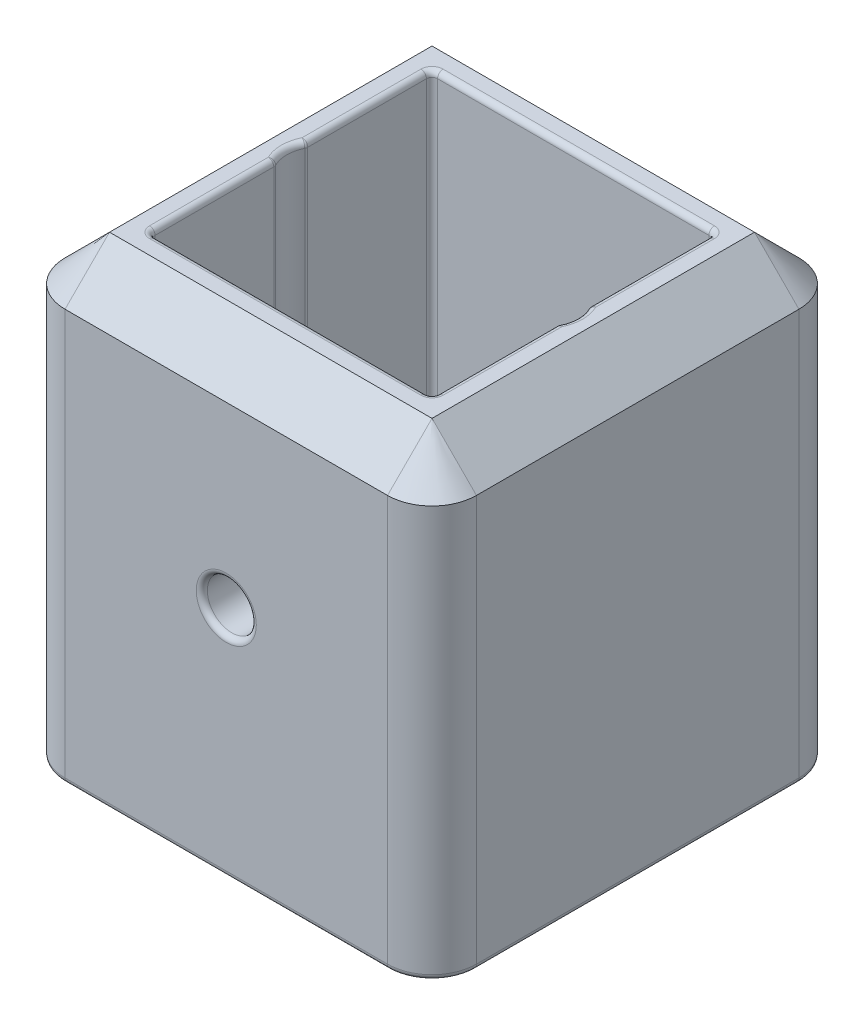
from build123d import *

# Parameters (mm, degrees)
SKIZZE1_W                        = 37
SKIZZE1_H                        = 37
SKIZZE1_R                        = 1.7
AUFSATZ_LINEAR_AUSTRAGEN1_DEPTH  = 6
SKIZZE2_W                        = 37
SKIZZE2_H                        = 37
AUFSATZ_LINEAR_AUSTRAGEN2_DEPTH  = 35
VERRUNDUNG1_R                    = 4
VERRUNDUNG4_R                    = 0.5
VERRUNDUNG5_R                    = 0.5
FASE1_SIZE                       = 4
F_4_4_4_4_DURCHMESSER_BOHRUNG1_D = 4.4
VERRUNDUNG6_R                    = 0.5
SKIZZE5_R                        = 5.5
SCHNITT_LINEAR_AUSTRAGEN1_DEPTH  = 2


with BuildPart() as part:
    # Skizze1 → Aufsatz-Linear austragen1 (new body)
    with BuildSketch(Plane(origin=(0, 0, 0), x_dir=(1, 0, 0), z_dir=(0, 1, 0))):
        Rectangle(SKIZZE1_W, SKIZZE1_H)
        with Locations(Location((10.25, 0, 0), (0, 0, 270))):
            Circle(SKIZZE1_R, mode=Mode.SUBTRACT)
        with Locations(Location((5.125, -8.876760389, 0), (0, 0, 270))):
            Circle(SKIZZE1_R, mode=Mode.SUBTRACT)
        with Locations(Location((-5.125, -8.876760389, 0), (0, 0, 270))):
            Circle(SKIZZE1_R, mode=Mode.SUBTRACT)
        with Locations(Location((-10.25, 0, 0), (0, 0, 270))):
            Circle(SKIZZE1_R, mode=Mode.SUBTRACT)
        with Locations(Location((-5.125, 8.876760389, 0), (0, 0, 270))):
            Circle(SKIZZE1_R, mode=Mode.SUBTRACT)
        with Locations(Location((5.125, 8.876760389, 0), (0, 0, 270))):
            Circle(SKIZZE1_R, mode=Mode.SUBTRACT)
    extrude(amount=-AUFSATZ_LINEAR_AUSTRAGEN1_DEPTH)

    # Skizze2 → Aufsatz-Linear austragen2 (add)
    with BuildSketch(Plane(origin=(0, 0, 0), x_dir=(1, 0, 0), z_dir=(0, 1, 0))):
        Rectangle(SKIZZE2_W, SKIZZE2_H)
        with BuildLine():
            Line((12.7, 12.7), (7.592597401, 12.7))
            Line((7.592597401, 12.7), (-2.657402599, 12.7))
            Line((-2.657402599, 12.7), (-12.7, 12.7))
            Line((-12.7, 12.7), (-12.7, 3.905508149))
            Line((-12.7, 3.905508149), (-12.7, 1.406236111))
            ThreePointArc((-12.7, 1.406236111), (-13.05, 0), (-12.7, -1.406236111))
            Line((-12.7, -1.406236111), (-12.7, -12.7))
            Line((-12.7, -12.7), (-7.592597401, -12.7))
            Line((-7.592597401, -12.7), (12.7, -12.7))
            Line((12.7, -12.7), (12.7, -3.905508149))
            Line((12.7, -3.905508149), (12.7, -1.406236111))
            ThreePointArc((12.7, -1.406236111), (13.05, 0), (12.7, 1.406236111))
            Line((12.7, 1.406236111), (12.7, 12.7))
        make_face(mode=Mode.SUBTRACT)
    extrude(amount=AUFSATZ_LINEAR_AUSTRAGEN2_DEPTH)

    # Verrundung1
    verrundung1_edges = [part.edges().sort_by_distance(p)[0] for p in [
        (-18.5, 14.5, -18.5),
        (18.5, 14.5, -18.5),
        (18.5, 14.5, 18.5),
        (-18.5, 14.5, 18.5),
    ]]
    fillet(verrundung1_edges, radius=VERRUNDUNG1_R)

    # Verrundung4
    verrundung4_edges = [part.edges().sort_by_distance(p)[0] for p in [
        (-10.25, -6, -1.7),
        (-10.25, 0, -1.7),
        (-5.125, -6, -10.576760389),
        (-5.125, 0, -10.576760389),
        (5.125, -6, -10.576760389),
        (5.125, 0, -10.576760389),
        (10.25, -6, -1.7),
        (10.25, 0, -1.7),
        (-5.125, -6, 7.176760389),
        (-5.125, 0, 7.176760389),
        (5.125, -6, 7.176760389),
        (5.125, 0, 7.176760389),
        (-18.5, -6, 0),
        (0, -6, 18.5),
        (0, -6, -18.5),
        (18.5, -6, 0),
        (17.328427125, -6, -17.328427125),
        (-17.328427125, -6, -17.328427125),
        (17.328427125, -6, 17.328427125),
        (-17.328427125, -6, 17.328427125),
    ]]
    fillet(verrundung4_edges, radius=VERRUNDUNG4_R)

    # Verrundung5
    verrundung5_edges = [part.edges().sort_by_distance(p)[0] for p in [
        (12.7, 0, -7.053118056),
        (0, 0, -12.7),
        (-12.7, 0, -7.053118056),
        (-13.05, 0, 0),
        (-12.7, 0, 7.053118056),
        (0, 0, 12.7),
        (12.7, 0, 7.053118056),
        (13.05, 0, 0),
        (12.7, 35, -7.053118056),
        (12.7, 17.5, -12.7),
        (0, 35, -12.7),
        (-12.7, 17.5, -12.7),
        (-12.7, 35, -7.053118056),
        (-12.7, 17.5, -1.406236111),
        (-13.05, 35, 0),
        (-12.7, 17.5, 1.406236111),
        (-12.7, 35, 7.053118056),
        (-12.7, 17.5, 12.7),
        (0, 35, 12.7),
        (12.7, 17.5, 12.7),
        (12.7, 35, 7.053118056),
        (12.7, 17.5, 1.406236111),
        (13.05, 35, 0),
        (12.7, 17.5, -1.406236111),
    ]]
    fillet(verrundung5_edges, radius=VERRUNDUNG5_R)

    # Fase1
    fase1_edges = [part.edges().sort_by_distance(p)[0] for p in [
        (-18.5, 35, 0),
        (0, 35, -18.5),
        (0, 35, 18.5),
        (18.5, 35, 0),
        (17.328427125, 35, -17.328427125),
        (-17.328427125, 35, -17.328427125),
        (17.328427125, 35, 17.328427125),
        (-17.328427125, 35, 17.328427125),
    ]]
    chamfer(fase1_edges, length=FASE1_SIZE - 0.0001)  # a hair under: the kernel refuses the full size

    # Ø4.4 (4.4) Durchmesser Bohrung1 (through all)
    with Locations(Plane.XY.offset(18.5)):
        with Locations((0, 15)):
            Hole(F_4_4_4_4_DURCHMESSER_BOHRUNG1_D / 2)

    # Verrundung6
    verrundung6_edges = [part.edges().sort_by_distance(p)[0] for p in [
        (2.2, 15, -12.7),
        (2.2, 15, 12.7),
        (2.2, 15, 18.5),
        (2.2, 15, -18.5),
    ]]
    fillet(verrundung6_edges, radius=VERRUNDUNG6_R)

    # Skizze5 → Schnitt-Linear austragen1 (cut)
    with BuildSketch(Plane.XZ.offset(6)):
        with Locations(Location((0, 0, 0), (0, 0, 270))):
            Circle(SKIZZE5_R)
    extrude(amount=-SCHNITT_LINEAR_AUSTRAGEN1_DEPTH, mode=Mode.SUBTRACT)


solid = part.part
